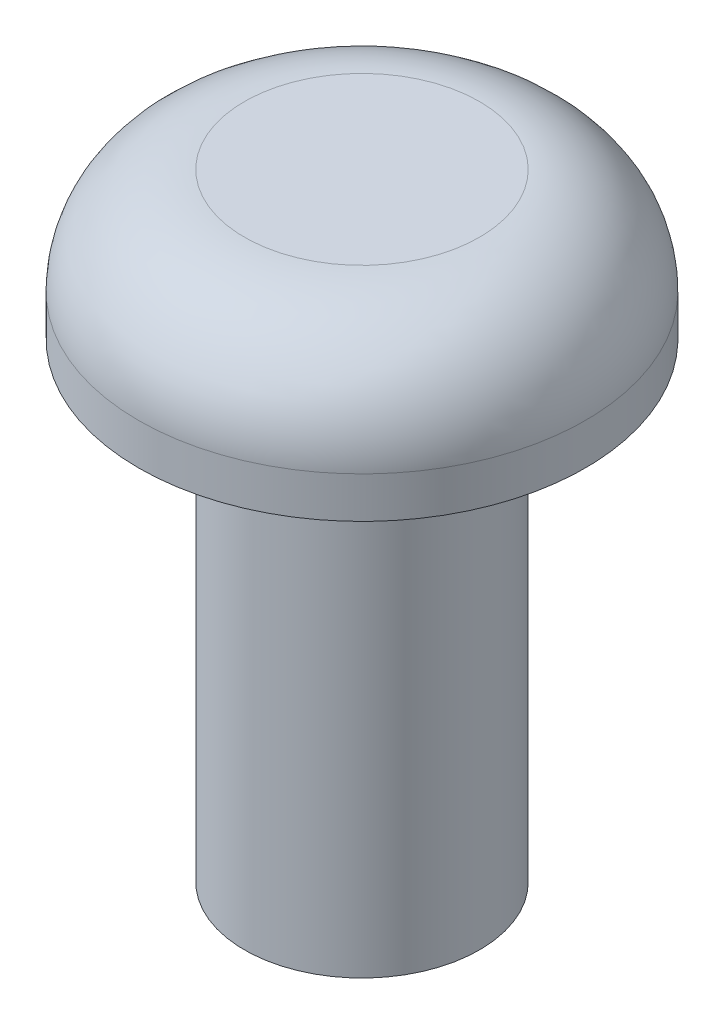
from build123d import *


with BuildPart() as part:
    # Sketch1 → Revolve1 (revolve)
    with BuildSketch(Plane.XY):
        with BuildLine():
            Line((2, 0), (3.8, 0))
            Line((3.8, 0), (3.8, 0.7))
            ThreePointArc((3.8, 0.7), (3.272792206, 1.972792206), (2, 2.5))
            Line((2, 2.5), (0, 2.5))
            Line((0, 2.5), (0, -8))
            Line((0, -8), (2, -8))
            Line((2, -8), (2, 0))
        make_face()
    revolve(axis=Axis((0, -8, 0), (0, 1, 0)))


solid = part.part
